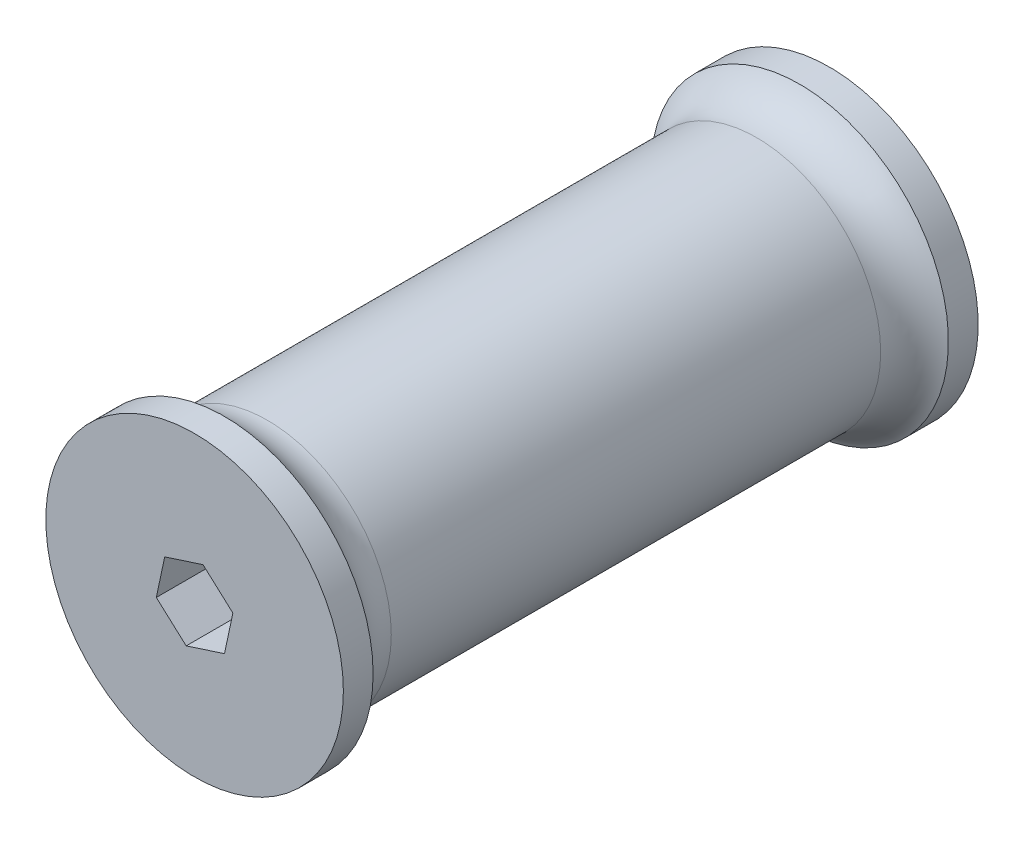
from build123d import *

# Parameters (mm, degrees)
CROQUIS1_R              = 15
SALIENTE_EXTRUIR1_DEPTH = 3
CROQUIS3_R              = 9
SALIENTE_EXTRUIR3_DEPTH = 58
SALIENTE_EXTRUIR4_START = 3
CROQUIS4_R              = 15
SALIENTE_EXTRUIR4_DEPTH = 3
CORTAR_EXTRUIR1_DEPTH   = 8
CROQUIS8_R              = 12.5
CROQUIS8_R_2            = 9
SALIENTE_EXTRUIR7_DEPTH = 58
REDONDEO3_R             = 5
CORTAR_EXTRUIR2_DEPTH   = 40


with BuildPart() as part:
    # Croquis1 → Saliente-Extruir1 (new body)
    with BuildSketch(Plane.XY):
        Circle(CROQUIS1_R)
    extrude(amount=SALIENTE_EXTRUIR1_DEPTH)

    # Croquis3 → Saliente-Extruir3 (add)
    with BuildSketch(Plane(origin=(0, 0, 0), x_dir=(-1, 0, 0), z_dir=(0, 0, -1))):
        with Locations(Location((0, 0, 0), (0, 0, 180))):
            Circle(CROQUIS3_R)
    extrude(amount=SALIENTE_EXTRUIR3_DEPTH)

    # Croquis4 → Saliente-Extruir4 (add)
    with BuildSketch(Plane(origin=(0, 0, -58), x_dir=(-1, 0, 0), z_dir=(0, 0, -1)).offset(SALIENTE_EXTRUIR4_START)):
        with Locations(Location((0, 0, 0), (0, 0, 180))):
            Circle(CROQUIS4_R)
    extrude(amount=-SALIENTE_EXTRUIR4_DEPTH)

    # Croquis5 → Cortar-Extruir1 (cut)
    with BuildSketch(Plane(origin=(0, 0, -61), x_dir=(-1, 0, 0), z_dir=(0, 0, -1))):
        with BuildLine():
            Line((2.045621727, 0.133909486), (-0.160815889, 2.043682522))
            ThreePointArc((-0.160815889, 2.043682522), (-1.341615267, -1.550022089), (2.045621727, 0.133909486))
        make_face()
    extrude(amount=-CORTAR_EXTRUIR1_DEPTH, mode=Mode.SUBTRACT)

    # Croquis8 → Saliente-Extruir7 (add)
    with BuildSketch(Plane(origin=(0, 0, 0), x_dir=(-1, 0, 0), z_dir=(0, 0, -1))):
        with Locations(Location((0, 0, 0), (0, 0, 180))):
            Circle(CROQUIS8_R)
        Circle(CROQUIS8_R_2, mode=Mode.SUBTRACT)
    extrude(amount=SALIENTE_EXTRUIR7_DEPTH)

    # Redondeo3
    # the kernel refuses this fillet: 5 mm, written as the material it adds along each edge
    with BuildSketch(Plane(origin=(0, 0, -58), x_dir=(1, 0, 0), z_dir=(0, 1, 0))) as redondeo3_piece_1:
        with BuildLine():
            CenterArc((17.5, -4.330127019), REDONDEO3_R, 120, 60)
            Line((12.5, -4.330127019), (12.4, -4.330127019))
            Line((12.4, -4.330127019), (12.4, 0))
            Line((12.4, 0), (12.5, 0.1))
            ThreePointArc((12.5, 0.1), (13.75, 0.1), (14.95, 0.08660254))
            Line((14.95, 0.08660254), (15, 0))
        make_face()
    revolve(axis=Axis((0, 0, -58), (0, 0, -1)))
    with BuildSketch(Plane(origin=(0, 0, 0), x_dir=(1, 0, 0), z_dir=(0, 1, 0))) as redondeo3_piece_2:
        with BuildLine():
            CenterArc((17.5, 4.330127019), REDONDEO3_R, 180, 60)
            Line((15, 0), (14.95, -0.08660254))
            ThreePointArc((14.95, -0.08660254), (13.75, -0.1), (12.5, -0.1))
            Line((12.5, -0.1), (12.4, 0))
            Line((12.4, 0), (12.4, 4.330127019))
            Line((12.4, 4.330127019), (12.5, 4.330127019))
        make_face()
    revolve(axis=Axis((0, 0, 0), (0, 0, -1)))

    # Croquis2 → Cortar-Extruir2 (cut)
    with BuildSketch(Plane.XY.offset(3)):
        Polygon((3.013979252, -2.718374956), (3.861171395, 1.250995121), (0.847192143, 3.969370077), (-3.013979252, 2.718374956), (-3.861171395, -1.250995121), (-0.847192143, -3.969370077), align=None)
    extrude(amount=-CORTAR_EXTRUIR2_DEPTH, mode=Mode.SUBTRACT)


solid = part.part
